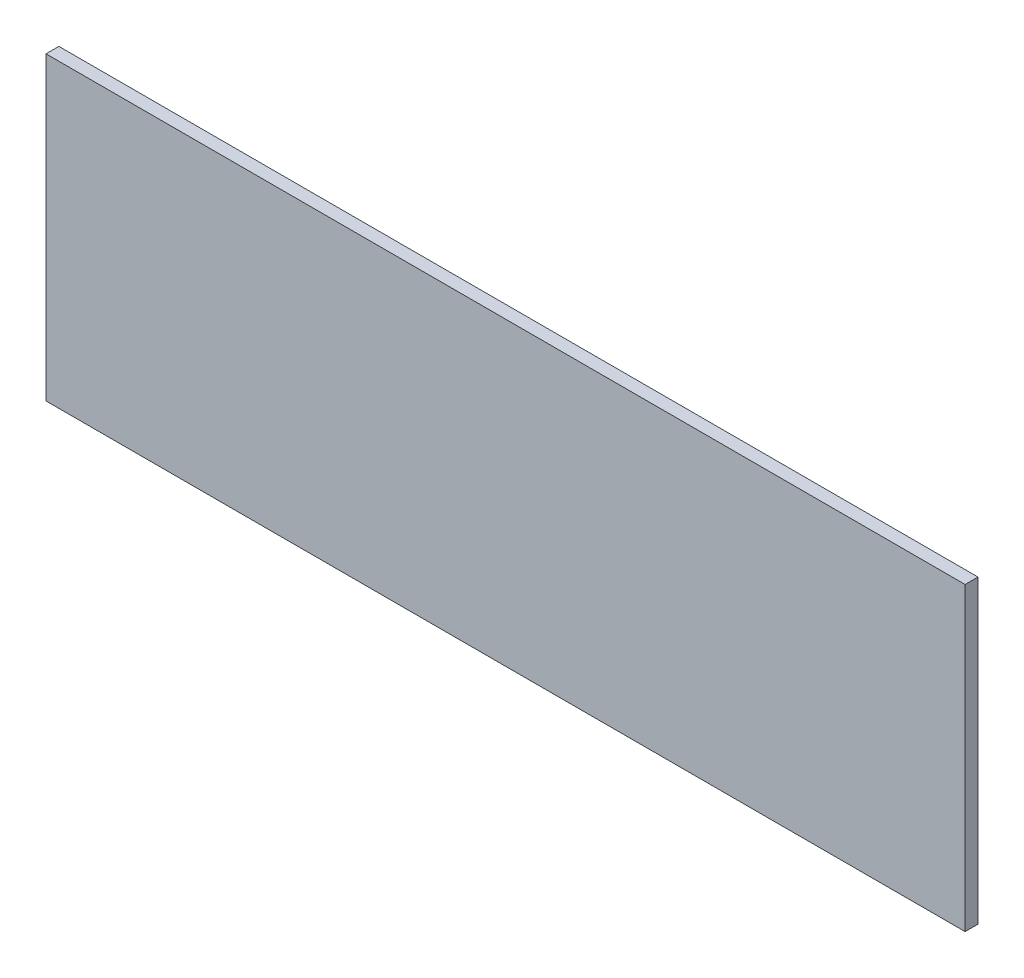
from build123d import *

# Parameters (mm, degrees)
SKETCH1_W           = 428
SKETCH1_H           = 140
BOSS_EXTRUDE1_DEPTH = 6


with BuildPart() as part:
    # Sketch1 → Boss-Extrude1 (new body)
    with BuildSketch(Plane.XY):
        with Locations((220, 180)):
            Rectangle(SKETCH1_W, SKETCH1_H)
    extrude(amount=-BOSS_EXTRUDE1_DEPTH)


solid = part.part
